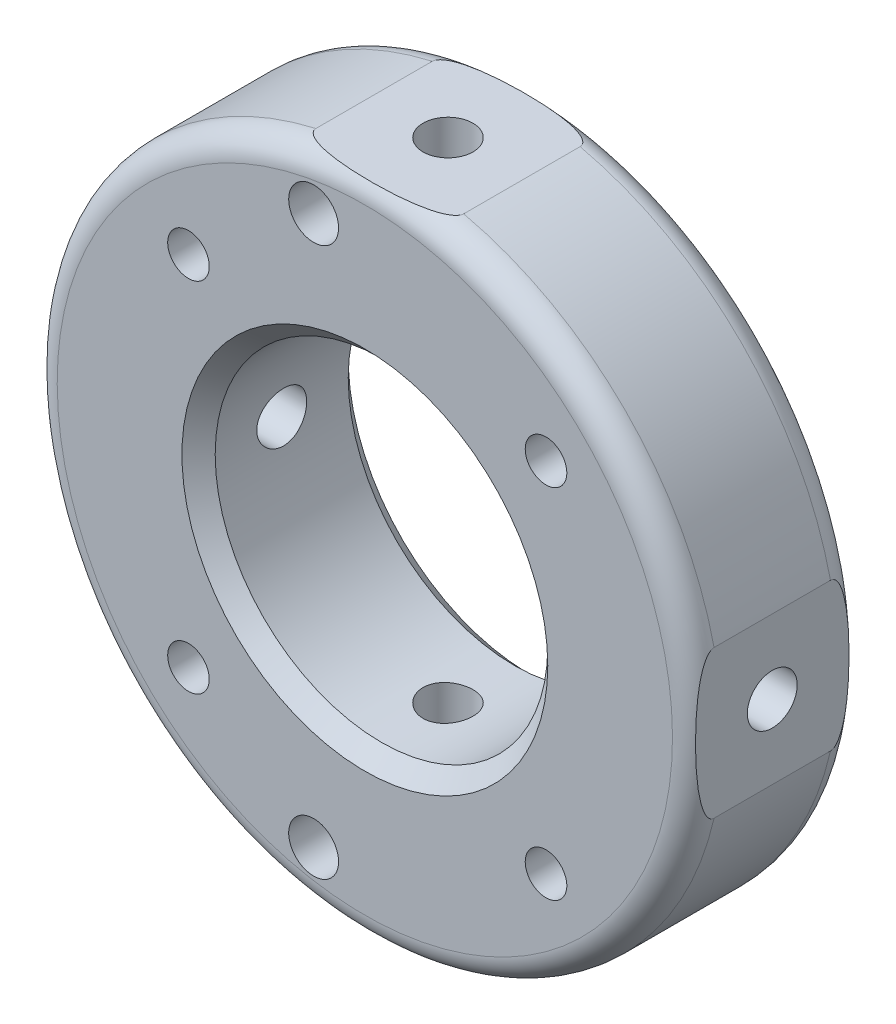
from build123d import *

# Parameters (mm, degrees)
SKETCH1_R           = 40
BOSS_EXTRUDE1_DEPTH = 20
SKETCH2_W           = 91.95154217
SKETCH2_H           = 92.440305864
SKETCH2_W_2         = 78
SKETCH2_H_2         = 78
CUT_EXTRUDE3_DEPTH  = 61
SKETCH3_R           = 2.5
CUT_EXTRUDE5_DEPTH  = 59.668560575
SKETCH5_R           = 3
CUT_EXTRUDE6_DEPTH  = 90.470665584
SKETCH6_R           = 3
CUT_EXTRUDE7_DEPTH  = 90.470665584
SKETCH7_R           = 20
CUT_EXTRUDE8_DEPTH  = 59.668560575
CHAMFER1_SIZE       = 2
SKETCH8_R           = 3
CUT_EXTRUDE9_DEPTH  = 5


with BuildPart() as part:
    # Sketch1 → Boss-Extrude1 (new body)
    with BuildSketch(Plane.XY):
        Circle(SKETCH1_R)
    extrude(amount=BOSS_EXTRUDE1_DEPTH)

    # Sketch2 → Cut-Extrude3 (cut, through all)
    with BuildSketch(Plane(origin=(0, 0, 0), x_dir=(-1, 0, 0), z_dir=(0, 0, -1))):
        Rectangle(SKETCH2_W, SKETCH2_H)
        Rectangle(SKETCH2_W_2, SKETCH2_H_2, mode=Mode.SUBTRACT)
    extrude(amount=-CUT_EXTRUDE3_DEPTH, mode=Mode.SUBTRACT)

    # Sketch3 → Cut-Extrude5 (cut, through all)
    with BuildSketch(Plane(origin=(0, 0, 0), x_dir=(-1, 0, 0), z_dir=(0, 0, -1))):
        with Locations((21.213203436, 21.213203436)):
            Circle(SKETCH3_R)
        with Locations((21.213203436, -21.786796564)):
            Circle(SKETCH3_R)
        with Locations((-21.786796564, -21.786796564)):
            Circle(SKETCH3_R)
        with Locations((-21.786796564, 21.213203436)):
            Circle(SKETCH3_R)
    extrude(amount=-CUT_EXTRUDE5_DEPTH, mode=Mode.SUBTRACT)

    # Sketch5 → Cut-Extrude6 (cut, through all)
    with BuildSketch(Plane(origin=(39, 0, 0), x_dir=(0, 0, -1), z_dir=(1, 0, 0))):
        with Locations((-10, 0)):
            Circle(SKETCH5_R)
    extrude(amount=-CUT_EXTRUDE6_DEPTH, mode=Mode.SUBTRACT)

    # Sketch6 → Cut-Extrude7 (cut, through all)
    with BuildSketch(Plane.XZ.offset(39)):
        with Locations((0, 10)):
            Circle(SKETCH6_R)
    extrude(amount=-CUT_EXTRUDE7_DEPTH, mode=Mode.SUBTRACT)

    # Sketch7 → Cut-Extrude8 (cut, through all)
    with BuildSketch(Plane(origin=(0, 0, 0), x_dir=(-1, 0, 0), z_dir=(0, 0, -1))):
        Circle(SKETCH7_R)
    extrude(amount=-CUT_EXTRUDE8_DEPTH, mode=Mode.SUBTRACT)

    # Fillet2: read off the stored shape, not the designer's step
    # Fillet2 outline → Fillet2 (revolve, cut)
    with BuildSketch(Plane.XZ):
        with BuildLine():
            ThreePointArc((37, 20), (39.121320386, 19.121320302), (40, 16.999999881))
            Line((40, 16.999999881), (40, 20))
            Line((40, 20), (37, 20))
        make_face()
        with BuildLine():
            Line((40, 0), (40, 3.000000119))
            ThreePointArc((40, 3.000000119), (39.121320386, 0.878679698), (37, 0))
            Line((37, 0), (40, 0))
        make_face()
    revolve(axis=Axis((0, 0, 0), (0, 0, 1)), mode=Mode.SUBTRACT)

    # Chamfer1
    chamfer1_edges = [part.edges().sort_by_distance(p)[0] for p in [
        (20, 0, 20),
        (20, 0, 0),
    ]]
    chamfer(chamfer1_edges, length=CHAMFER1_SIZE)

    # Sketch8 → Cut-Extrude9 (cut)
    with BuildSketch(Plane(origin=(150.63801623, 159.049980591, 20), x_dir=(0, -1, 0), z_dir=(0, 0, 1))):
        with Locations(Location((192.049980649, -156.798016257, 0), (0, 0, 90))):
            Circle(SKETCH8_R)
        with Locations(Location((126.049980533, -156.798016257, 0), (0, 0, 270))):
            Circle(SKETCH8_R)
    extrude(amount=-CUT_EXTRUDE9_DEPTH, mode=Mode.SUBTRACT)


solid = part.part
